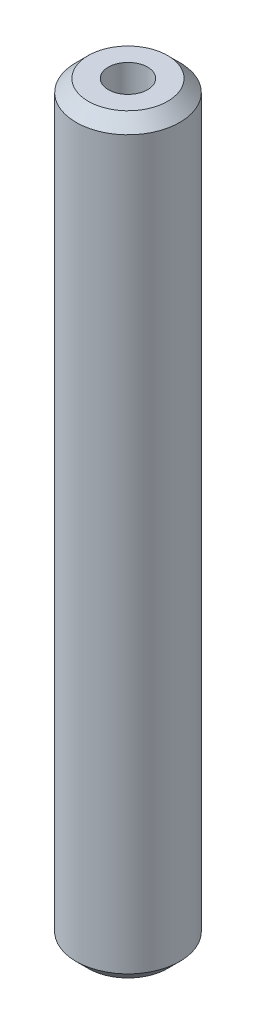
from build123d import *

# Parameters (mm, degrees)
SKETCH1_R           = 7.5
BOSS_EXTRUDE1_DEPTH = 108.602294326
SKETCH2_R           = 2.837141994
CUT_EXTRUDE1_DEPTH  = 110.119009952
CHAMFER1_SIZE       = 1.761033442


with BuildPart() as part:
    # Sketch1 → Boss-Extrude1 (new body)
    with BuildSketch(Plane(origin=(0, 0, 0), x_dir=(1, 0, 0), z_dir=(0, 1, 0))):
        Circle(SKETCH1_R)
    extrude(amount=BOSS_EXTRUDE1_DEPTH)

    # Sketch2 → Cut-Extrude1 (cut, through all)
    with BuildSketch(Plane(origin=(0, 0, 0), x_dir=(1, 0, 0), z_dir=(0, 1, 0))):
        Circle(SKETCH2_R)
    extrude(amount=CUT_EXTRUDE1_DEPTH, mode=Mode.SUBTRACT)

    # Chamfer1
    chamfer1_edges = [part.edges().sort_by_distance(p)[0] for p in [
        (-7.5, 108.602294326, 0),
        (-7.5, 0, 0),
    ]]
    chamfer(chamfer1_edges, length=CHAMFER1_SIZE)


solid = part.part
